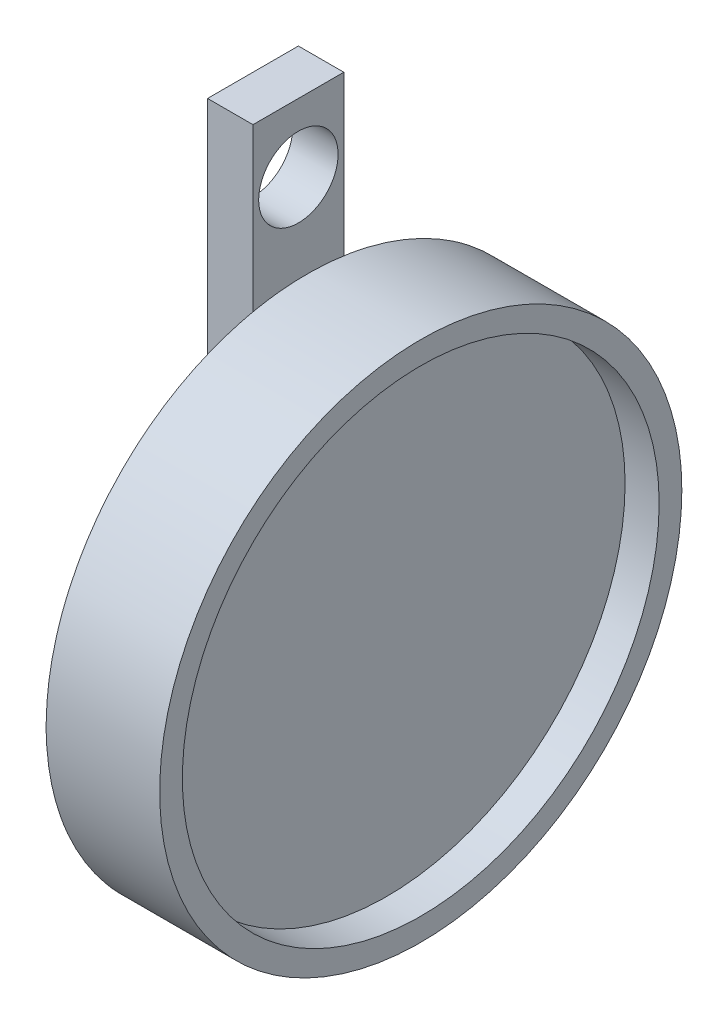
from build123d import *

# Parameters (mm, degrees)
SKETCH1_R           = 11.5
SKETCH1_R_2         = 10.5
BOSS_EXTRUDE1_DEPTH = 5
SKETCH1_2_R         = 10.5
BOSS_EXTRUDE2_DEPTH = 3.5
SKETCH3_R           = 9.5
CUT_EXTRUDE2_DEPTH  = 1.5
SKETCH6_W           = 23
SKETCH6_H           = 4
SKETCH6_R           = 1.75
BOSS_EXTRUDE3_DEPTH = 2


with BuildPart() as part:
    # Sketch1 → Boss-Extrude1 (new body)
    with BuildSketch(Plane.YZ):
        Circle(SKETCH1_R)
        Circle(SKETCH1_R_2, mode=Mode.SUBTRACT)
    extrude(amount=BOSS_EXTRUDE1_DEPTH)

    # Sketch1<2> → Boss-Extrude2 (add)
    with BuildSketch(Plane.YZ):
        Circle(SKETCH1_2_R)
    extrude(amount=BOSS_EXTRUDE2_DEPTH)

    # Sketch3 → Cut-Extrude2 (cut)
    with BuildSketch(Plane(origin=(0, 0, 0), x_dir=(0, -1, 0), z_dir=(-1, 0, 0))):
        Circle(SKETCH3_R)
    extrude(amount=-CUT_EXTRUDE2_DEPTH, mode=Mode.SUBTRACT)

    # Sketch4 for Loft1 → Loft1 section 0
    with BuildSketch(Plane(origin=(0, 0, 0), x_dir=(0, -1, 0), z_dir=(-1, 0, 0))):
        with BuildLine():
            # circular arc as an exact rational Bezier (weights 1, cos(half-angle), 1)
            Bezier((10.677481945, -4.270992778), (12.385879057, 0), (10.677481945, 4.270992778), weights=[1, 0.928476691, 1])
            Bezier((10.677481945, 4.270992778), (0, 30.964697642), (-10.677481945, 4.270992778), weights=[1, 0.371390676, 1])
            Bezier((-10.677481945, 4.270992778), (-12.385879057, 0), (-10.677481945, -4.270992778), weights=[1, 0.928476691, 1])
            Bezier((-10.677481945, -4.270992778), (0, -30.964697642), (10.677481945, -4.270992778), weights=[1, 0.371390676, 1])
        make_face()
    # Sketch2 → Loft1 section 1
    with BuildSketch(Plane.ZY.offset(2.39)):
        with BuildLine():
            Line((-2, -5), (2, -5))
            Line((2, -5), (2, 5))
            Line((2, 5), (-2, 5))
            Line((-2, 5), (-2, -5))
        make_face()
    loft()

    # Sketch6 → Boss-Extrude3 (add)
    with BuildSketch(Plane(origin=(-2.39, 0, 0), x_dir=(0, -1, 0), z_dir=(-1, 0, 0))):
        with Locations((-6.5, 0)):
            Rectangle(SKETCH6_W, SKETCH6_H)
        with Locations((-15, 0)):
            Circle(SKETCH6_R, mode=Mode.SUBTRACT)
    extrude(amount=-BOSS_EXTRUDE3_DEPTH)


solid = part.part
